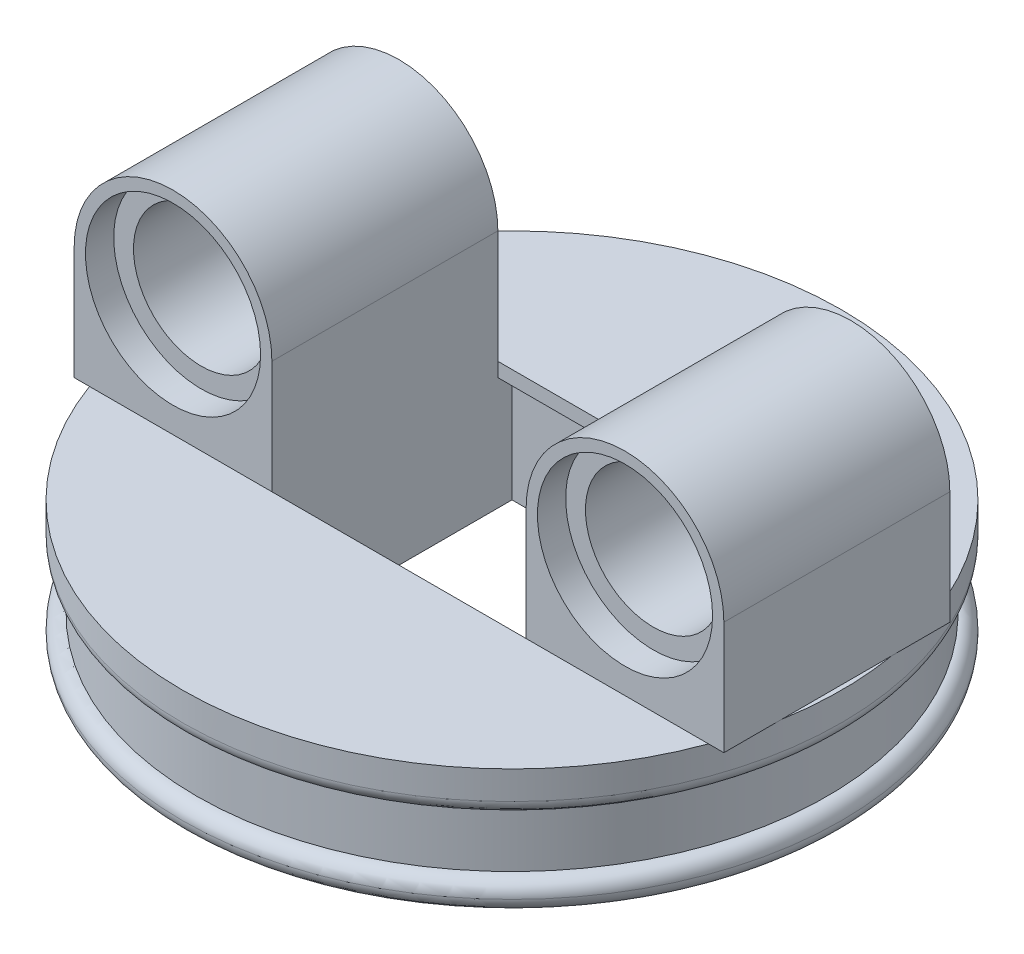
from build123d import *

# Parameters (mm, degrees)
BOSS_EXTRUDE1_DEPTH   = 4
BOSS_EXTRUDE1_2_DEPTH = 4
SKETCH7_R             = 2.4
CUT_EXTRUDE1_DEPTH    = 8
SKETCH8_R             = 3.1
CUT_EXTRUDE2_DEPTH    = 1
SKETCH9_R             = 2.4
CUT_EXTRUDE3_DEPTH    = 8
SKETCH10_R            = 3.1
CUT_EXTRUDE4_DEPTH    = 1
SKETCH11_R            = 11.665
BOSS_EXTRUDE2_DEPTH   = 0.5
SKETCH13_R            = 11.665
SKETCH13_R_2          = 10.665
BOSS_EXTRUDE3_DEPTH   = 1
SKETCH14_R            = 11.165
SKETCH14_R_2          = 10.665
BOSS_EXTRUDE4_DEPTH   = 2
SKETCH15_R            = 11.665
SKETCH15_R_2          = 10.665
BOSS_EXTRUDE5_DEPTH   = 1
FILLET1_R             = 0.5
FILLET2_R             = 0.5
FILLET3_R             = 0.5
SKETCH16_W            = 9
SKETCH16_H            = 8
CUT_EXTRUDE5_DEPTH    = 0.5
SKETCH18_W            = 10
SKETCH18_H            = 10
SKETCH18_W_2          = 9
SKETCH18_H_2          = 9
BOSS_EXTRUDE6_DEPTH   = 4


with BuildPart() as part:
    # Sketch6 → Boss-Extrude1 (new, symmetric)
    with BuildSketch(Plane.XY):
        with BuildLine():
            Line((-11.5, 4), (-11.5, 0))
            Line((-11.5, 0), (-4.5, 0))
            Line((-4.5, 0), (-4.5, 4))
            ThreePointArc((-4.5, 4), (-8, 7.5), (-11.5, 4))
        make_face()
    extrude(amount=BOSS_EXTRUDE1_DEPTH, both=True)

    # Sketch7 → Cut-Extrude1 (cut)
    with BuildSketch(Plane.XY.offset(4)):
        with Locations((-8, 4)):
            Circle(SKETCH7_R)
    extrude(amount=-CUT_EXTRUDE1_DEPTH, mode=Mode.SUBTRACT)

    # Sketch8 → Cut-Extrude2 (cut)
    with BuildSketch(Plane.XY.offset(4)):
        with Locations((-8, 4)):
            Circle(SKETCH8_R)
    cut_extrude2 = extrude(amount=-CUT_EXTRUDE2_DEPTH, mode=Mode.SUBTRACT)

    # Mirror1: Cut-Extrude2 across plane
    add(cut_extrude2.mirror(Plane.XY), mode=Mode.SUBTRACT)



with BuildPart() as body_2:
    # Sketch6 → Boss-Extrude1 2 (new, symmetric)
    with BuildSketch(Plane.XY):
        with BuildLine():
            Line((4.5, 4), (4.5, 0))
            Line((4.5, 0), (11.5, 0))
            Line((11.5, 0), (11.5, 4))
            ThreePointArc((11.5, 4), (8, 7.5), (4.5, 4))
        make_face()
    extrude(amount=BOSS_EXTRUDE1_2_DEPTH, both=True)

    # Sketch9 → Cut-Extrude3 (cut)
    with BuildSketch(Plane.XY.offset(4)):
        with Locations((8, 4)):
            Circle(SKETCH9_R)
    extrude(amount=-CUT_EXTRUDE3_DEPTH, mode=Mode.SUBTRACT)

    # Sketch10 → Cut-Extrude4 (cut)
    with BuildSketch(Plane.XY.offset(4)):
        with Locations((8, 4)):
            Circle(SKETCH10_R)
    cut_extrude4 = extrude(amount=-CUT_EXTRUDE4_DEPTH, mode=Mode.SUBTRACT)

    # Mirror3: Cut-Extrude4 across plane
    add(cut_extrude4.mirror(Plane.XY), mode=Mode.SUBTRACT)


with BuildPart() as part_1:
    add(part.part)

    add(body_2.part)  # Boss-Extrude2 merges body 2
    # Sketch11 → Boss-Extrude2 (add)
    with BuildSketch(Plane(origin=(0, 0, 0), x_dir=(1, 0, 0), z_dir=(0, 1, 0))):
        with Locations(Location((0, 0, 0), (0, 0, 270))):
            Circle(SKETCH11_R)
    extrude(amount=-BOSS_EXTRUDE2_DEPTH)

    # Sketch13 → Boss-Extrude3 (add)
    with BuildSketch(Plane.XZ.offset(0.5)):
        with Locations(Location((0, 0, 0), (0, 0, 20.054030419))):
            Circle(SKETCH13_R)
        with Locations(Location((0, 0, 0), (0, 0, 270))):
            Circle(SKETCH13_R_2, mode=Mode.SUBTRACT)
    extrude(amount=BOSS_EXTRUDE3_DEPTH)

    # Sketch14 → Boss-Extrude4 (add)
    with BuildSketch(Plane.XZ.offset(1.5)):
        with Locations(Location((0, 0, 0), (0, 0, 270))):
            Circle(SKETCH14_R)
        with Locations(Location((0, 0, 0), (0, 0, 270))):
            Circle(SKETCH14_R_2, mode=Mode.SUBTRACT)
    extrude(amount=BOSS_EXTRUDE4_DEPTH)

    # Sketch15 → Boss-Extrude5 (add)
    with BuildSketch(Plane.XZ.offset(3.5)):
        with Locations(Location((0, 0, 0), (0, 0, 20.054030419))):
            Circle(SKETCH15_R)
        with Locations(Location((0, 0, 0), (0, 0, 270))):
            Circle(SKETCH15_R_2, mode=Mode.SUBTRACT)
    extrude(amount=BOSS_EXTRUDE5_DEPTH)

    # Fillet1
    fillet1_edges = [part_1.edges().sort_by_distance(p)[0] for p in [
        (-10.957747259, -3.5, -4),
    ]]
    fillet(fillet1_edges, radius=FILLET1_R - 0.0001)  # a hair under: the kernel refuses the full size

    # Fillet2
    fillet2_edges = [part_1.edges().sort_by_distance(p)[0] for p in [
        (-10.957747259, -4.5, -4),
    ]]
    fillet(fillet2_edges, radius=FILLET2_R)

    # Fillet3
    fillet3_edges = [part_1.edges().sort_by_distance(p)[0] for p in [
        (-10.957747259, -1.5, -4),
    ]]
    fillet(fillet3_edges, radius=FILLET3_R - 0.0001)  # a hair under: the kernel refuses the full size

    # Sketch16 → Cut-Extrude5 (cut)
    with BuildSketch(Plane(origin=(0, 0, 0), x_dir=(1, 0, 0), z_dir=(0, 1, 0))):
        Rectangle(SKETCH16_W, SKETCH16_H)
    extrude(amount=-CUT_EXTRUDE5_DEPTH, mode=Mode.SUBTRACT)

    # Sketch18 → Boss-Extrude6 (add)
    with BuildSketch(Plane.XZ.offset(0.5)):
        Rectangle(SKETCH18_W, SKETCH18_H)
        Rectangle(SKETCH18_W_2, SKETCH18_H_2, mode=Mode.SUBTRACT)
    extrude(amount=BOSS_EXTRUDE6_DEPTH)


solid = part_1.part
